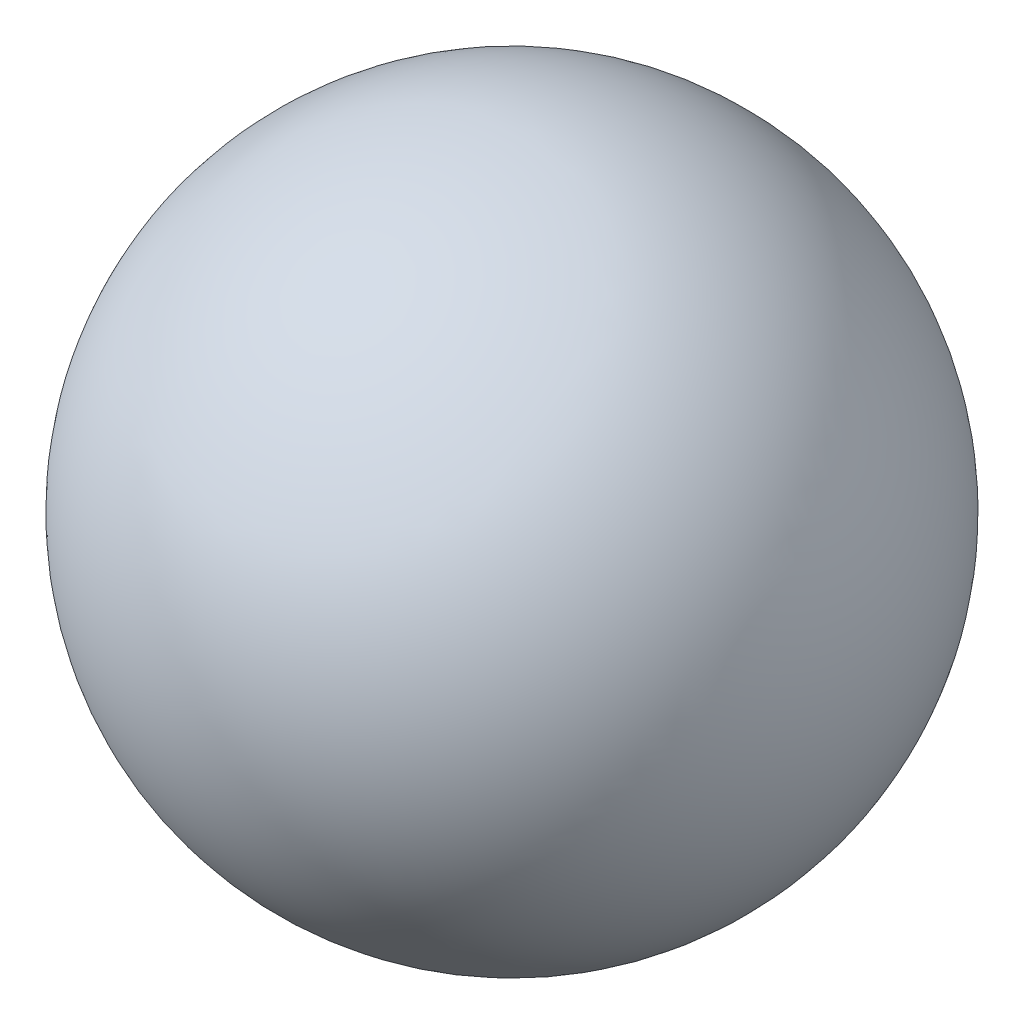
from build123d import *


with BuildPart() as part:
    # 草圖1 → 旋轉2 (revolve)
    with BuildSketch(Plane.XY):
        with BuildLine():
            ThreePointArc((7.5, 0), (0, 7.5), (-7.5, 0))
            Line((-7.5, 0), (7.5, 0))
        make_face()
    revolve(axis=Axis((-7.5, 0, 0), (1, 0, 0)))


solid = part.part
